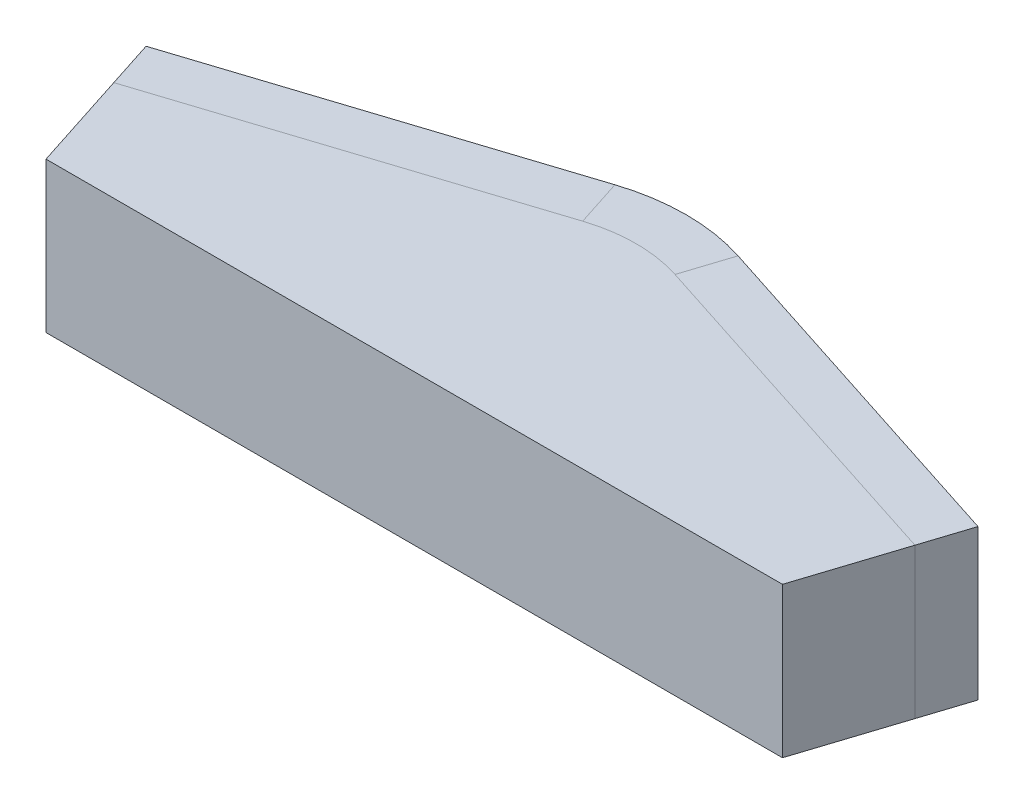
from build123d import *

# Parameters (mm, degrees)
BOSS_EXTRUDE1_DEPTH    = 4.7625
BOSS_EXTRUDE2_DEPTH    = 9.525
CONVERT_SOLID1_START   = -4.7625
CONVERT_SOLID1_DEPTH   = 9.525
CONVERT_SOLID1_2_DEPTH = 9.525


# Read off the part's stored shape, not the designer's step: Convert-Solid1
with BuildPart() as part:
    # Sketch1 → Boss-Extrude1 (new, symmetric)
    with BuildSketch(Plane(origin=(0, 0, 0), x_dir=(1, 0, 0), z_dir=(0, 1, 0))):
        Polygon((0, 3.33650554), (26.375857262, -5.182664231), (25.4, -8.203976463), (0, 0), (-25.4, -8.203976463), (-26.375857262, -5.182664231), align=None)
    extrude(amount=BOSS_EXTRUDE1_DEPTH, both=True)

    # Convert-Solid1 outline → Convert-Solid1 (cut)
    with BuildSketch(Plane(origin=(0, 0, 0), x_dir=(1, 0, 0), z_dir=(0, 1, 0)).offset(CONVERT_SOLID1_START)):
        with BuildLine():
            ThreePointArc((-3.903429046, 2.07573231), (0, 2.690483381), (3.903429046, 2.07573231))
            Line((3.903429046, 2.07573231), (0, 3.33650554))
            Line((0, 3.33650554), (-3.903429046, 2.07573231))
        make_face()
    extrude(amount=CONVERT_SOLID1_DEPTH, mode=Mode.SUBTRACT)

    # Convert-Solid1 2 outline → Convert-Solid1 2 (add)
    with BuildSketch(Plane(origin=(0, 0, 0), x_dir=(1, 0, 0), z_dir=(0, 1, 0)).offset(CONVERT_SOLID1_START)):
        with BuildLine():
            ThreePointArc((-2.927571785, -0.945579922), (0, -0.484516619), (2.927571785, -0.945579922))
            Line((2.927571785, -0.945579922), (0, 0))
            Line((0, 0), (-2.927571785, -0.945579922))
        make_face()
    extrude(amount=CONVERT_SOLID1_2_DEPTH)


with BuildPart() as body_2:
    # Sketch3 → Boss-Extrude2 (new body)
    with BuildSketch(Plane(origin=(0, 4.7625, 0), x_dir=(1, 0, 0), z_dir=(0, 1, 0))):
        with BuildLine():
            Line((-25.4, -8.203976463), (-2.927571785, -0.945579922))
            ThreePointArc((-2.927571785, -0.945579922), (0, -0.484516619), (2.927571785, -0.945579922))
            Line((2.927571785, -0.945579922), (25.4, -8.203976463))
            Line((25.4, -8.203976463), (23.349005884, -14.553976463))
            Line((23.349005884, -14.553976463), (-23.349005884, -14.553976463))
            Line((-23.349005884, -14.553976463), (-25.4, -8.203976463))
        make_face()
    extrude(amount=-BOSS_EXTRUDE2_DEPTH)


solid = Compound([part.part, body_2.part])
